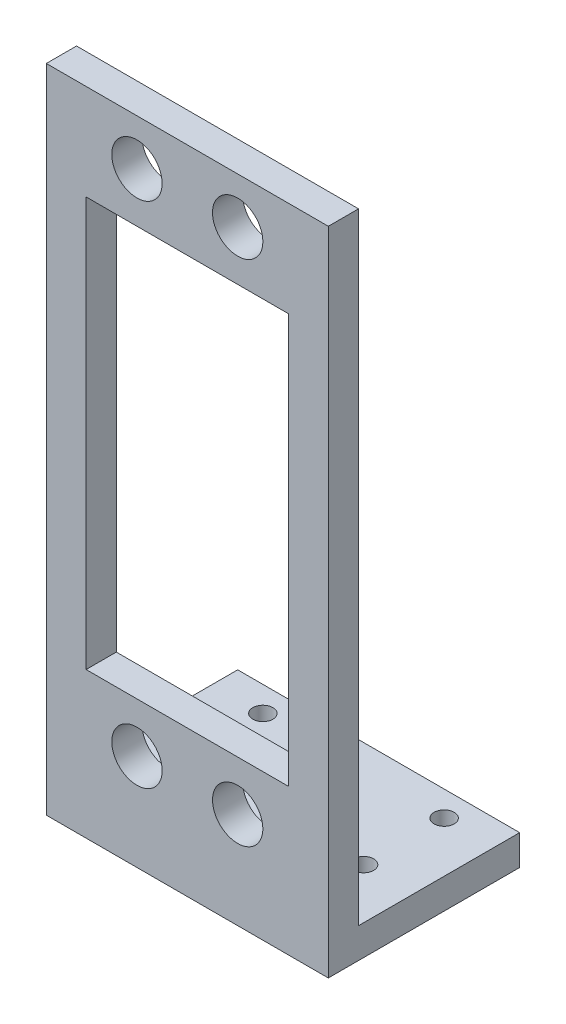
from build123d import *

# Parameters (mm, degrees)
SKETCH1_W           = 28
SKETCH1_H           = 64.64
BOSS_EXTRUDE1_DEPTH = 3
SKETCH2_R           = 2.5
CUT_EXTRUDE1_DEPTH  = 71.507656322
SKETCH4_W           = 20.1
SKETCH4_H           = 40.64
CUT_EXTRUDE6_DEPTH  = 10
SKETCH5_W           = 28
SKETCH5_H           = 3
BOSS_EXTRUDE2_DEPTH = 16
SKETCH6_R           = 1
CUT_EXTRUDE7_DEPTH  = 10


with BuildPart() as part:
    # Sketch1 → Boss-Extrude1 (new body)
    with BuildSketch(Plane.XY):
        with Locations((14, 32.32)):
            Rectangle(SKETCH1_W, SKETCH1_H)
    extrude(amount=BOSS_EXTRUDE1_DEPTH)

    # Sketch2 → Cut-Extrude1 (cut, through all)
    with BuildSketch(Plane.XY.offset(3)):
        with Locations((9, 9.57)):
            Circle(SKETCH2_R)
        with Locations((19, 9.57)):
            Circle(SKETCH2_R)
        with Locations((9, 60.07)):
            Circle(SKETCH2_R)
        with Locations((19, 60.07)):
            Circle(SKETCH2_R)
    extrude(amount=-CUT_EXTRUDE1_DEPTH, mode=Mode.SUBTRACT)

    # Sketch4 → Cut-Extrude6 (cut)
    with BuildSketch(Plane.XY.offset(3)):
        with Locations((14, 34.82)):
            Rectangle(SKETCH4_W, SKETCH4_H)
    extrude(amount=-CUT_EXTRUDE6_DEPTH, mode=Mode.SUBTRACT)

    # Sketch5 → Boss-Extrude2 (add)
    with BuildSketch(Plane(origin=(0, 0, 0), x_dir=(-1, 0, 0), z_dir=(0, 0, -1))):
        with Locations((-14, 1.5)):
            Rectangle(SKETCH5_W, SKETCH5_H)
    extrude(amount=BOSS_EXTRUDE2_DEPTH)

    # Sketch6 → Cut-Extrude7 (cut)
    with BuildSketch(Plane(origin=(0, 3, 0), x_dir=(1, 0, 0), z_dir=(0, 1, 0))):
        with Locations((5, 5.5)):
            Circle(SKETCH6_R)
        with Locations((5, 13.5)):
            Circle(SKETCH6_R)
        with Locations((23, 13.5)):
            Circle(SKETCH6_R)
        with Locations((23, 5.5)):
            Circle(SKETCH6_R)
    extrude(amount=-CUT_EXTRUDE7_DEPTH, mode=Mode.SUBTRACT)


solid = part.part
